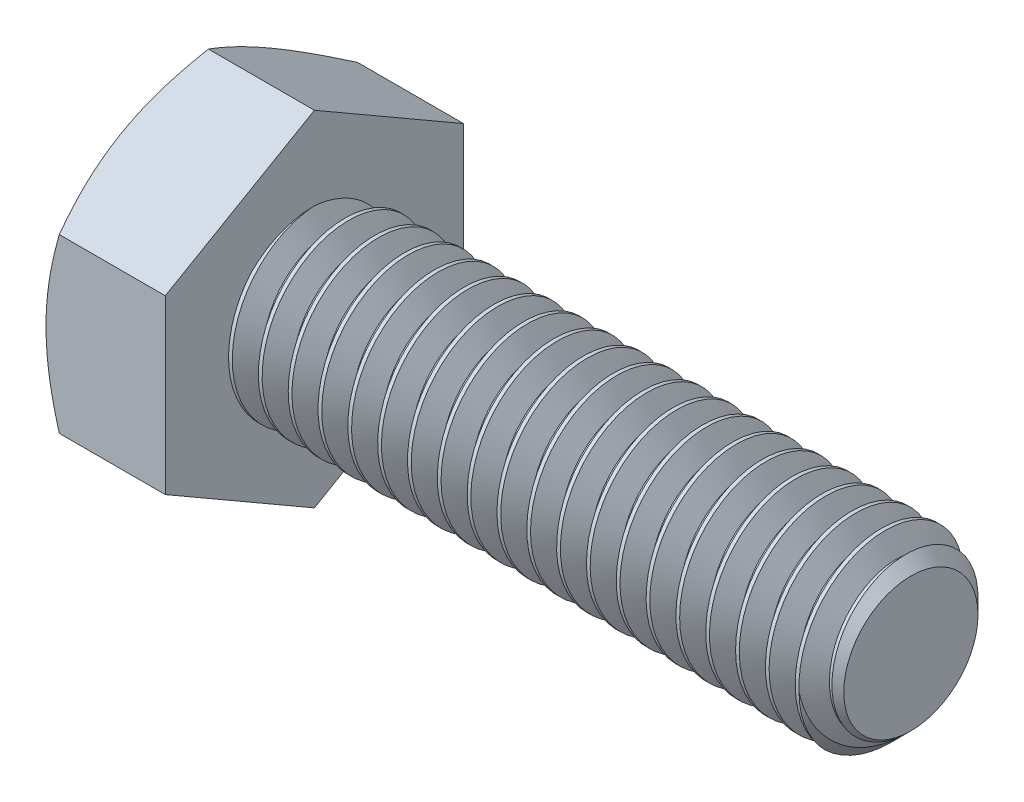
from build123d import *

# Parameters (mm, degrees)
SKETCH2_R           = 3
BOSS_EXTRUDE1_DEPTH = 20
CHAMFER1_SIZE       = 0.75
CUT_SWEEP1_PITCH    = 1
BOSS_EXTRUDE2_DEPTH = 4
SKETCH6_OUTSIDE_W   = 108.4
SKETCH6_OUTSIDE_H   = 109.948
SKETCH6_OUTSIDE_R   = 5
CUT_EXTRUDE1_DEPTH  = 26.185975071
CUT_EXTRUDE1_DRAFT  = -60
SKETCH7_W           = 0.197562976
SKETCH7_H           = 0.197562976
CUT_EXTRUDE2_DEPTH  = 0.25


with BuildPart() as part:
    # Sketch2 → Boss-Extrude1 (new body)
    with BuildSketch(Plane(origin=(12, 0, 0), x_dir=(0, 0, -1), z_dir=(1, 0, 0))):
        Circle(SKETCH2_R)
    extrude(amount=-BOSS_EXTRUDE1_DEPTH)

    # Chamfer1
    chamfer1_edges = [part.edges().sort_by_distance(p)[0] for p in [
        (12, 0, 3),
    ]]
    chamfer(chamfer1_edges, length=CHAMFER1_SIZE)

    # Cut-Sweep1: the profile of Sketch5 profile screwed along a right-hand helix of 21 turns, 8 arcs to a turn; built about Z, then put on its axis
    cut_sweep1_z = Axis((0, 0, 0), (0, 0, 1))
    cut_sweep1_corners = [(3.0003, 0, 0.000173205), (2.350480947, 0, -0.375), (2.350480947, 0, -0.5), (3.0003, 0, -0.875173205)]
    with BuildLine(mode=Mode.PRIVATE) as cut_sweep1_profile:
        Line(cut_sweep1_corners[0], cut_sweep1_corners[1])
        Line(cut_sweep1_corners[1], cut_sweep1_corners[2])
        Line(cut_sweep1_corners[2], cut_sweep1_corners[3])
        Line(cut_sweep1_corners[3], cut_sweep1_corners[0])
    cut_sweep1_cap = Face(cut_sweep1_profile.wire())
    cut_sweep1_turn_angles = [0, 22.5, 45, 67.5, 90, 112.5, 135, 157.5, 180, 202.5, 225, 247.5, 270, 292.5, 315, 337.5, 360]
    cut_sweep1_turn_weights = [1, 0.9238795325112867, 1, 0.9238795325112867, 1, 0.9238795325112867, 1, 0.9238795325112867, 1, 0.9238795325112867, 1, 0.9238795325112867, 1, 0.9238795325112867, 1, 0.9238795325112867, 1]
    cut_sweep1_turn_rails = [Edge.make_bspline([Vector(p[0], p[1], 0).rotate(cut_sweep1_z, cut_sweep1_turn_angles[k]) / cut_sweep1_turn_weights[k] + Vector(0, 0, p[2] + CUT_SWEEP1_PITCH * cut_sweep1_turn_angles[k] / 360) for k in range(17)], [0, 0, 0, 1, 1, 2, 2, 3, 3, 4, 4, 5, 5, 6, 6, 7, 7, 8, 8, 8], 2, cut_sweep1_turn_weights) for p in cut_sweep1_corners]
    cut_sweep1_turn_sides = [Face.make_surface_from_curves(cut_sweep1_turn_rails[p[0]], cut_sweep1_turn_rails[p[1]]) for p in [(0, 1), (1, 2), (2, 3), (3, 0)]]
    cut_sweep1 = Plane(origin=(12, 0, 0), x_dir=(0, 1, 0), z_dir=(-1, 0, 0)) * Solid(Shell([*[p.moved(Location((0, 0, CUT_SWEEP1_PITCH * i))) for i in range(21) for p in cut_sweep1_turn_sides], cut_sweep1_cap, cut_sweep1_cap.rotate(cut_sweep1_z, 7560).moved(Location((0, 0, CUT_SWEEP1_PITCH * 7560 / 360)))]))
    add(cut_sweep1, mode=Mode.SUBTRACT)

    # Sketch3 → Boss-Extrude2 (add)
    with BuildSketch(Plane.ZY.offset(8)):
        Polygon((-5, -2.886751346), (0, -5.773502692), (5, -2.886751346), (5, 2.886751346), (0, 5.773502692), (-5, 2.886751346), align=None)
    extrude(amount=BOSS_EXTRUDE2_DEPTH)


with BuildPart() as cut_extrude1_tool:
    # Sketch6 outside → Cut-Extrude1 (with draft: the straight prism first)
    with BuildSketch(Plane.ZY.offset(12)):
        Rectangle(SKETCH6_OUTSIDE_W, SKETCH6_OUTSIDE_H)
        Circle(SKETCH6_OUTSIDE_R, mode=Mode.SUBTRACT)
    extrude(amount=-CUT_EXTRUDE1_DEPTH)
    # Cut-Extrude1: the draft: its side faces are tilted about the plane it starts from
    cut_extrude1_sides = [cut_extrude1_tool.faces().sort_by_distance(p)[0] for p in [
        (1.092987536, -54.974, 0),
        (1.092987536, 0, 54.2),
        (1.092987536, 54.974, 0),
        (1.092987536, 0, -54.2),
        (1.092987536, 0, -5),
    ]]
    draft(cut_extrude1_sides, Plane.ZY.offset(12), CUT_EXTRUDE1_DRAFT)


with BuildPart() as part_1:
    add(part.part)

    # Cut-Extrude1: cut by cut_extrude1_tool
    add(cut_extrude1_tool.part, mode=Mode.SUBTRACT)

    # Sketch7 → Cut-Extrude2 (cut)
    # profile 1 of 4: a face of its own
    with BuildSketch(Plane.ZY.offset(12)):
        with BuildLine():
            Line((-1.284159342, 2.5), (-1.481722318, 2.5))
            Line((-1.481722318, 2.5), (-1.481722318, 3.700812462))
            add(Edge.make_bspline(
                [(-1.481722318, 3.700812462), (-1.493098012, 3.689842005), (-1.516741144, 3.667041113), (-1.556707362, 3.634772156), (-1.601314769, 3.602066201), (-1.649984109, 3.570615769), (-1.699594268, 3.541008578), (-1.7475361, 3.514381463), (-1.793009194, 3.491848462), (-1.822962567, 3.479527328), (-1.837335675, 3.47361504)],
                knots=[0, 0, 0, 0, 0.893362401, 1.856755847, 2.901947673, 4.020460078, 5.132200827, 6.168787962, 7.121294059, 8, 8, 8, 8], degree=3))
            Line((-1.837335675, 3.47361504), (-1.837335675, 3.655743408))
            add(Edge.make_bspline(
                [(-1.837335675, 3.655743408), (-1.812648378, 3.668457416), (-1.763991177, 3.693515971), (-1.695249075, 3.736795542), (-1.631070927, 3.783712378), (-1.572519137, 3.834256092), (-1.520031188, 3.885920841), (-1.475798832, 3.938052602), (-1.438788011, 3.98874045), (-1.42021898, 4.024089603), (-1.411340508, 4.040991211)],
                knots=[0, 0, 0, 0, 1.141258006, 2.249351951, 3.335817539, 4.406819942, 5.426913362, 6.360259544, 7.215985427, 8, 8, 8, 8], degree=3))
            Line((-1.411340508, 4.040991211), (-1.284159342, 4.040991211))
            Line((-1.284159342, 4.040991211), (-1.284159342, 2.5))
        make_face()
    # profile 2 of 4: a face of its own
    with BuildSketch(Plane.ZY.offset(12)):
        with BuildLine():
            add(Edge.make_bspline(
                [(-0.790251903, 3.260000072), (-0.790052858, 3.282022251), (-0.789663013, 3.325154426), (-0.787244933, 3.388264546), (-0.783023159, 3.448197614), (-0.776721214, 3.50490158), (-0.769258531, 3.558504437), (-0.759556995, 3.608929689), (-0.748641356, 3.656290471), (-0.735544549, 3.700537418), (-0.721155446, 3.742050974), (-0.704830549, 3.780764541), (-0.686462825, 3.816637074), (-0.666954934, 3.85004059), (-0.645279941, 3.880455529), (-0.622746104, 3.908735457), (-0.597715799, 3.933843239), (-0.57122984, 3.956424902), (-0.542898213, 3.976351902), (-0.512870822, 3.993546501), (-0.481263204, 4.008728091), (-0.447472952, 4.020156788), (-0.412201546, 4.029473599), (-0.375177484, 4.036327159), (-0.336359967, 4.040367563), (-0.309833651, 4.04078098), (-0.296344464, 4.040991211)],
                knots=[0, 0, 0, 0, 1.514747001, 2.966751498, 4.343369068, 5.64627492, 6.890416844, 8.064737671, 9.177176366, 10.232018008, 11.237056675, 12.19799043, 13.119080079, 14.007588942, 14.855863561, 15.685992447, 16.491747269, 17.290132607, 18.077525251, 18.870243746, 19.668095604, 20.485086593, 21.319398728, 22.175900658, 23.072407314, 24, 24, 24, 24], degree=3))
            add(Edge.make_bspline(
                [(-0.296344464, 4.040991211), (-0.276554072, 4.040409387), (-0.237675053, 4.039266372), (-0.180911485, 4.029944144), (-0.127415481, 4.013997036), (-0.077221797, 3.992483699), (-0.031188485, 3.965157621), (0.009921203, 3.93193861), (0.045663832, 3.893175459), (0.075649327, 3.848408838), (0.101859643, 3.798873708), (0.125144312, 3.744347738), (0.146192977, 3.68489203), (0.161129567, 3.631670872), (0.171783825, 3.585728479), (0.178836097, 3.547836494), (0.184690897, 3.506950828), (0.189176465, 3.463170395), (0.192856768, 3.416544299), (0.195698897, 3.36704351), (0.197141568, 3.314544309), (0.197419873, 3.278522328), (0.197562976, 3.260000072)],
                knots=[0, 0, 0, 0, 1.134486744, 2.228744715, 3.287356444, 4.328707449, 5.352829806, 6.347195599, 7.349461267, 8.364207941, 9.428085653, 10.559314403, 11.761222316, 13.04268526, 13.726896727, 14.465273606, 15.252205015, 16.094778733, 16.988606776, 17.934225168, 18.937792761, 20, 20, 20, 20], degree=3))
            add(Edge.make_bspline(
                [(0.197562976, 3.260000072), (0.197360203, 3.238081335), (0.196964045, 3.195258767), (0.194610758, 3.132654684), (0.190134593, 3.073173782), (0.184626591, 3.016679807), (0.176294137, 2.963323573), (0.167315467, 2.912878383), (0.156211069, 2.865573301), (0.143254845, 2.821387596), (0.128663193, 2.78008763), (0.11266119, 2.74136128), (0.094937435, 2.705235008), (0.074964401, 2.672061172), (0.053655947, 2.641399446), (0.03085601, 2.613134809), (0.006081205, 2.587674071), (-0.020643434, 2.565160142), (-0.048776137, 2.544879764), (-0.07887653, 2.527515404), (-0.110812868, 2.513129332), (-0.144371773, 2.500829956), (-0.179893749, 2.491817695), (-0.217098671, 2.484918949), (-0.256123623, 2.480856468), (-0.282752541, 2.480450776), (-0.296344464, 2.480243702)],
                knots=[0, 0, 0, 0, 1.508974709, 2.94807912, 4.311757619, 5.615040294, 6.854280449, 8.028314546, 9.141715822, 10.197470207, 11.196696834, 12.155719058, 13.080757287, 13.963948316, 14.818758719, 15.649605906, 16.461113142, 17.260189315, 18.052359509, 18.845763934, 19.647754795, 20.461145776, 21.303032214, 22.167241874, 23.064524267, 24, 24, 24, 24], degree=3))
            add(Edge.make_bspline(
                [(-0.296344464, 2.480243702), (-0.31416505, 2.480752036), (-0.348910289, 2.481743145), (-0.399653148, 2.488477126), (-0.447278028, 2.500329248), (-0.492186617, 2.516224614), (-0.533874131, 2.537485582), (-0.572539611, 2.563353701), (-0.608960011, 2.593227122), (-0.629925808, 2.616796566), (-0.64053621, 2.628724626)],
                knots=[0, 0, 0, 0, 1.10322584, 2.150986741, 3.161425019, 4.136713905, 5.093944212, 6.049774532, 7.013026876, 8, 8, 8, 8], degree=3))
            add(Edge.make_bspline(
                [(-0.64053621, 2.628724626), (-0.652749028, 2.646341795), (-0.677932381, 2.682669151), (-0.707407312, 2.744610663), (-0.733699472, 2.81279957), (-0.754333998, 2.888573732), (-0.770495975, 2.971330072), (-0.782168957, 3.061230974), (-0.788774716, 3.158237599), (-0.789748392, 3.225313505), (-0.790251903, 3.260000072)],
                knots=[0, 0, 0, 0, 0.779365345, 1.607084704, 2.489375761, 3.438383567, 4.461919411, 5.557722155, 6.737039282, 8, 8, 8, 8], degree=3))
        make_face()
        with BuildLine():
            add(Edge.make_bspline(
                [(-0.592688927, 3.260617457), (-0.592492763, 3.230978591), (-0.592117261, 3.174243246), (-0.588194178, 3.093187016), (-0.581440751, 3.020063233), (-0.57251228, 2.954973141), (-0.560723083, 2.897828693), (-0.545920352, 2.84877551), (-0.529234153, 2.807224843), (-0.508585298, 2.77369168), (-0.485977083, 2.746357261), (-0.462635646, 2.722848776), (-0.438011843, 2.702867102), (-0.412266343, 2.686206461), (-0.384999685, 2.673592119), (-0.356510025, 2.664449215), (-0.326791165, 2.659187614), (-0.30655127, 2.658431621), (-0.296344464, 2.658050381)],
                knots=[0, 0, 0, 0, 1.89448813, 3.626469325, 5.185477471, 6.587276848, 7.82441448, 8.910550357, 9.859733512, 10.6775885, 11.416198291, 12.123144072, 12.791880183, 13.439617036, 14.078171869, 14.70637855, 15.347637704, 16, 16, 16, 16], degree=3))
            add(Edge.make_bspline(
                [(-0.296344464, 2.658050381), (-0.286140213, 2.658439952), (-0.265905387, 2.659212463), (-0.236117858, 2.66435804), (-0.207739045, 2.673971614), (-0.180513042, 2.686541403), (-0.154580415, 2.702822298), (-0.130077548, 2.722879447), (-0.106613153, 2.746373973), (-0.084106493, 2.774026105), (-0.063614954, 2.807714303), (-0.046615742, 2.849231123), (-0.032043703, 2.898370213), (-0.020189817, 2.955485547), (-0.011224514, 3.020472726), (-0.00451192, 3.093393697), (-0.000562582, 3.174345633), (-0.000193277, 3.230978457), (0, 3.260617457)],
                knots=[0, 0, 0, 0, 0.652509534, 1.29391342, 1.924290653, 2.562989607, 3.207355802, 3.876242846, 4.583348185, 5.32723334, 6.150888545, 7.094226006, 8.186903555, 9.424320409, 10.81992305, 12.379283064, 14.105084285, 16, 16, 16, 16], degree=3))
            add(Edge.make_bspline(
                [(0, 3.260617457), (-0.000187089, 3.289639765), (-0.000545544, 3.345245408), (-0.00459674, 3.424740087), (-0.010945329, 3.496636517), (-0.01962919, 3.56100098), (-0.03117004, 3.6177636), (-0.045167517, 3.667045216), (-0.061847603, 3.708740728), (-0.081680166, 3.743268967), (-0.103757778, 3.77159149), (-0.126819935, 3.796107098), (-0.151443196, 3.816956825), (-0.178063809, 3.833682782), (-0.205823744, 3.847176663), (-0.235360851, 3.856463495), (-0.266384805, 3.862169035), (-0.287676143, 3.862842166), (-0.298505309, 3.863184533)],
                knots=[0, 0, 0, 0, 1.850066095, 3.544656626, 5.0727657, 6.45041401, 7.682899467, 8.762389858, 9.712573485, 10.538438529, 11.291566246, 11.996865408, 12.681389046, 13.341983376, 13.996294293, 14.643563182, 15.31009126, 16, 16, 16, 16], degree=3))
            add(Edge.make_bspline(
                [(-0.298505309, 3.863184533), (-0.308711474, 3.862916661), (-0.328836725, 3.862388453), (-0.358302727, 3.857346709), (-0.386227312, 3.84891579), (-0.412930404, 3.837495291), (-0.437745374, 3.822125556), (-0.461656324, 3.804180295), (-0.483543356, 3.782315999), (-0.49673229, 3.765970592), (-0.503476896, 3.757611818)],
                knots=[0, 0, 0, 0, 1.021318143, 2.013908504, 2.982026795, 3.937174072, 4.91255697, 5.897578595, 6.924855925, 8, 8, 8, 8], degree=3))
            add(Edge.make_bspline(
                [(-0.503476896, 3.757611818), (-0.510819714, 3.745335366), (-0.5263262, 3.719410087), (-0.543677057, 3.674350882), (-0.559004117, 3.622856788), (-0.57162337, 3.56413553), (-0.580752514, 3.49828784), (-0.58795962, 3.425390186), (-0.591703443, 3.345340795), (-0.592351369, 3.289637751), (-0.592688927, 3.260617457)],
                knots=[0, 0, 0, 0, 0.671104906, 1.417232262, 2.260109084, 3.195198885, 4.23592645, 5.382417421, 6.636286093, 8, 8, 8, 8], degree=3))
        make_face(mode=Mode.SUBTRACT)
    # profile 3 of 4: a face of its own
    with BuildSketch(Plane.ZY.offset(12)):
        with Locations((0.592688927, 2.598781488)):
            Rectangle(SKETCH7_W, SKETCH7_H)
    # profile 4 of 4: a face of its own
    with BuildSketch(Plane.ZY.offset(12)):
        with BuildLine():
            Line((1.007571176, 2.875369654), (1.205134152, 2.895125952))
            add(Edge.make_bspline(
                [(1.205134152, 2.895125952), (1.206920239, 2.885003602), (1.210372897, 2.865436243), (1.218164458, 2.837549402), (1.226067012, 2.811547623), (1.236268145, 2.788010165), (1.246891881, 2.766297683), (1.258922971, 2.746627755), (1.272575767, 2.729395444), (1.291855309, 2.709202247), (1.319210172, 2.688130304), (1.357127719, 2.671061208), (1.398840582, 2.65958445), (1.428236664, 2.658573426), (1.443444492, 2.658050381)],
                knots=[0, 0, 0, 0, 0.994516507, 1.922484754, 2.80151264, 3.623050913, 4.402748861, 5.140924173, 5.850441436, 6.526872911, 7.841975818, 9.161260782, 10.53140107, 12, 12, 12, 12], degree=3))
            add(Edge.make_bspline(
                [(1.443444492, 2.658050381), (1.456751488, 2.658529578), (1.482941721, 2.659472712), (1.521127946, 2.666783962), (1.557442454, 2.678496432), (1.591253108, 2.695301374), (1.622436856, 2.71575252), (1.649674808, 2.7400526), (1.673330676, 2.767155041), (1.692759492, 2.798382253), (1.709342511, 2.83404897), (1.725011258, 2.8746088), (1.739833634, 2.920760517), (1.753006889, 2.971915473), (1.764802895, 3.026206092), (1.773081217, 3.082402208), (1.778174547, 3.13941128), (1.778719417, 3.177774463), (1.778992858, 3.197026874)],
                knots=[0, 0, 0, 0, 0.897794352, 1.766998465, 2.614902619, 3.466100941, 4.308008728, 5.124841802, 5.922729683, 6.728261092, 7.598214292, 8.574707161, 9.662086263, 10.868425066, 12.139522319, 13.41071447, 14.70057738, 16, 16, 16, 16], degree=3))
            add(Edge.make_bspline(
                [(1.778992858, 3.197026874), (1.778899344, 3.202274865), (1.778675616, 3.214830375), (1.778290769, 3.227382036), (1.778066782, 3.234687316)],
                knots=[0, 0, 0, 0, 0.835966126, 2, 2, 2, 2], degree=3))
            add(Edge.make_bspline(
                [(1.778066782, 3.234687316), (1.768542584, 3.22022413), (1.749509536, 3.191321063), (1.714445959, 3.152529649), (1.674332612, 3.118121138), (1.629778386, 3.088362715), (1.58188343, 3.063940569), (1.531480967, 3.046194448), (1.479005485, 3.035236452), (1.443291513, 3.034030076), (1.425231655, 3.033420035)],
                knots=[0, 0, 0, 0, 0.978840568, 1.956103883, 2.947027447, 3.962820877, 4.980997961, 5.980964245, 6.979013046, 8, 8, 8, 8], degree=3))
            add(Edge.make_bspline(
                [(1.425231655, 3.033420035), (1.410181713, 3.033809962), (1.380555612, 3.034577542), (1.337158587, 3.041399547), (1.295419155, 3.051630137), (1.255732843, 3.067119745), (1.21748219, 3.086276405), (1.181068826, 3.109789736), (1.146436643, 3.137627733), (1.114033143, 3.169443767), (1.084462099, 3.2049069), (1.05838385, 3.243153184), (1.036728508, 3.28436963), (1.018710514, 3.328041798), (1.004807734, 3.374591649), (0.995147123, 3.423910112), (0.988649898, 3.475808926), (0.98809691, 3.511357846), (0.987814879, 3.529488319)],
                knots=[0, 0, 0, 0, 0.975490236, 1.920271282, 2.842894855, 3.757591483, 4.67685385, 5.613562631, 6.563069669, 7.554119451, 8.55387214, 9.553424333, 10.550567425, 11.568071726, 12.613215376, 13.695622473, 14.824733476, 16, 16, 16, 16], degree=3))
            add(Edge.make_bspline(
                [(0.987814879, 3.529488319), (0.988237289, 3.548232953), (0.989063596, 3.584900708), (0.995305351, 3.63851352), (1.005631769, 3.689304987), (1.020691426, 3.737178163), (1.039315186, 3.782440645), (1.062799025, 3.824766099), (1.090238676, 3.864335583), (1.12179809, 3.900767612), (1.1564816, 3.933457226), (1.193305446, 3.962633275), (1.232749472, 3.986615849), (1.274057373, 4.006611333), (1.317541757, 4.022064144), (1.363128302, 4.033233279), (1.410943155, 4.039786979), (1.443527149, 4.040584988), (1.460113868, 4.040991211)],
                knots=[0, 0, 0, 0, 1.151671969, 2.252870106, 3.311924673, 4.331900944, 5.332425074, 6.314476151, 7.300265758, 8.286521684, 9.270545387, 10.225535917, 11.167946231, 12.101233205, 13.04124339, 13.998220545, 14.981004193, 16, 16, 16, 16], degree=3))
            add(Edge.make_bspline(
                [(1.460113868, 4.040991211), (1.472160605, 4.04074757), (1.49610549, 4.040263292), (1.53174045, 4.036565994), (1.56653158, 4.029901008), (1.600705712, 4.021487923), (1.633686425, 4.009809927), (1.666109474, 3.996305519), (1.697583789, 3.979788608), (1.728292766, 3.961006809), (1.758043531, 3.940290273), (1.78541595, 3.916489215), (1.811504082, 3.891230711), (1.835777069, 3.863722031), (1.857467159, 3.833538628), (1.878046883, 3.801747632), (1.896524197, 3.767655353), (1.913374225, 3.731215619), (1.928371403, 3.691678329), (1.940882807, 3.648169752), (1.951607872, 3.600539191), (1.960537546, 3.548723511), (1.967159045, 3.492759655), (1.972032081, 3.432730793), (1.975222249, 3.368591267), (1.975491252, 3.324417814), (1.975629758, 3.301673513)],
                knots=[0, 0, 0, 0, 0.850689348, 1.69088598, 2.526071361, 3.350886897, 4.173587108, 4.994166539, 5.82944675, 6.680632524, 7.535501428, 8.385942454, 9.238956306, 10.098905971, 10.972410977, 11.861345628, 12.77184846, 13.708225841, 14.694799433, 15.754852217, 16.902446579, 18.141290626, 19.466225842, 20.880733292, 22.39393263, 24, 24, 24, 24], degree=3))
            add(Edge.make_bspline(
                [(1.975629758, 3.301673513), (1.975490325, 3.277900399), (1.975218576, 3.231567557), (1.972003363, 3.163933366), (1.967132776, 3.099998865), (1.960506598, 3.039722069), (1.951514674, 2.983194972), (1.940827057, 2.930427456), (1.928222834, 2.881322105), (1.913411036, 2.835874606), (1.896572884, 2.793562676), (1.878123243, 2.753865304), (1.857460667, 2.716841197), (1.834817321, 2.682419349), (1.81048396, 2.650539597), (1.784080657, 2.621287341), (1.755598839, 2.594751007), (1.725401557, 2.570631953), (1.69353413, 2.54937701), (1.660430384, 2.530622167), (1.625716723, 2.515258667), (1.589750014, 2.502655004), (1.552594169, 2.492248635), (1.513946549, 2.485236805), (1.473985704, 2.481265544), (1.446951668, 2.480587277), (1.433257651, 2.480243702)],
                knots=[0, 0, 0, 0, 1.538356107, 2.998194159, 4.380716326, 5.687456969, 6.921258146, 8.08355215, 9.170518603, 10.200253214, 11.174652363, 12.115998813, 13.031191965, 13.915860606, 14.780247615, 15.624154577, 16.462764255, 17.29681422, 18.1223677, 18.939254916, 19.756006416, 20.575278551, 21.404021733, 22.250368457, 23.113728878, 24, 24, 24, 24], degree=3))
            add(Edge.make_bspline(
                [(1.433257651, 2.480243702), (1.418732748, 2.480494839), (1.390314716, 2.480986189), (1.348827314, 2.486152771), (1.309305056, 2.494007659), (1.271862965, 2.505603334), (1.236220636, 2.519877298), (1.202986414, 2.538118612), (1.171569683, 2.559163632), (1.142358031, 2.583436747), (1.115693486, 2.610848821), (1.091567168, 2.640724272), (1.070415495, 2.673450039), (1.052349162, 2.70883318), (1.036346581, 2.746576015), (1.023940229, 2.787184652), (1.013861262, 2.83028456), (1.00970173, 2.860098607), (1.007571176, 2.875369654)],
                knots=[0, 0, 0, 0, 1.08199657, 2.11693069, 3.111083497, 4.081436044, 5.034173265, 5.967546613, 6.901297947, 7.84883568, 8.792454994, 9.747011506, 10.706361727, 11.690764787, 12.70483191, 13.757514363, 14.851376857, 16, 16, 16, 16], degree=3))
        make_face()
        with BuildLine():
            add(Edge.make_bspline(
                [(1.778066782, 3.533810009), (1.777844584, 3.546167498), (1.777412091, 3.570220558), (1.773622923, 3.605313673), (1.767526176, 3.638360963), (1.758968941, 3.669552455), (1.747347963, 3.698557507), (1.733885852, 3.72605331), (1.717423045, 3.751277762), (1.698847657, 3.774570528), (1.678386493, 3.79540537), (1.656104474, 3.813571489), (1.632419371, 3.829143971), (1.606762975, 3.84138813), (1.579978695, 3.851477273), (1.551423134, 3.858071145), (1.521489215, 3.862690284), (1.500880058, 3.863017562), (1.490365698, 3.863184533)],
                knots=[0, 0, 0, 0, 1.20361398, 2.342757417, 3.433960756, 4.474970456, 5.487648377, 6.473933575, 7.452701285, 8.415527761, 9.372491588, 10.291530068, 11.211879743, 12.12647906, 13.055739058, 13.994253148, 14.97671008, 16, 16, 16, 16], degree=3))
            add(Edge.make_bspline(
                [(1.490365698, 3.863184533), (1.479550713, 3.862856809), (1.458245164, 3.862211193), (1.427017644, 3.858053397), (1.397402188, 3.850092498), (1.36919886, 3.839532546), (1.342094419, 3.826470071), (1.317074221, 3.809354236), (1.29309033, 3.789957753), (1.271104705, 3.76745525), (1.251021561, 3.742783687), (1.233326098, 3.716174633), (1.218424276, 3.687615052), (1.206512128, 3.657224018), (1.19677715, 3.625266419), (1.190089912, 3.591456506), (1.18597516, 3.555830273), (1.185579924, 3.531454958), (1.185377855, 3.518992786)],
                knots=[0, 0, 0, 0, 1.007165334, 1.984118292, 2.925321257, 3.856078893, 4.785899085, 5.718627206, 6.671847665, 7.654235469, 8.641842333, 9.630378272, 10.624608936, 11.635186472, 12.665777387, 13.731187195, 14.840042241, 16, 16, 16, 16], degree=3))
            add(Edge.make_bspline(
                [(1.185377855, 3.518992786), (1.185564481, 3.50786364), (1.185930382, 3.48604371), (1.190287864, 3.454199511), (1.196100099, 3.423807131), (1.2053659, 3.395176801), (1.216528497, 3.367892863), (1.231036441, 3.342581934), (1.247371005, 3.318487167), (1.266510109, 3.29641574), (1.287668429, 3.276393087), (1.31077761, 3.258941189), (1.335545758, 3.244002062), (1.36220298, 3.231978182), (1.390589415, 3.222718025), (1.420641701, 3.215900682), (1.452490468, 3.211840104), (1.474301842, 3.211433897), (1.485426624, 3.211226713)],
                knots=[0, 0, 0, 0, 1.102204012, 2.160993585, 3.181057555, 4.164839289, 5.138418409, 6.097303793, 7.050641095, 8.019669129, 8.986440483, 9.932879371, 10.884360123, 11.847412593, 12.824617322, 13.839006415, 14.897795988, 16, 16, 16, 16], degree=3))
            add(Edge.make_bspline(
                [(1.485426624, 3.211226713), (1.495831895, 3.211435921), (1.516311795, 3.211847691), (1.546312698, 3.215925579), (1.574819195, 3.222755565), (1.601959278, 3.232041219), (1.627688956, 3.244060942), (1.651835213, 3.259118787), (1.674864814, 3.276371256), (1.696102673, 3.296529924), (1.715513299, 3.318849511), (1.732299881, 3.343550515), (1.746634721, 3.37018436), (1.7579177, 3.399066744), (1.76695483, 3.429842075), (1.773317571, 3.462705196), (1.777484418, 3.497585953), (1.777869725, 3.521552704), (1.778066782, 3.533810009)],
                knots=[0, 0, 0, 0, 1.017004716, 2.00169281, 2.953445817, 3.879374072, 4.80207141, 5.723561102, 6.657273834, 7.611045633, 8.581233951, 9.544037932, 10.525327521, 11.53237926, 12.57032081, 13.657564536, 14.802009319, 16, 16, 16, 16], degree=3))
        make_face(mode=Mode.SUBTRACT)
    extrude(amount=-CUT_EXTRUDE2_DEPTH, mode=Mode.SUBTRACT)


solid = part_1.part
